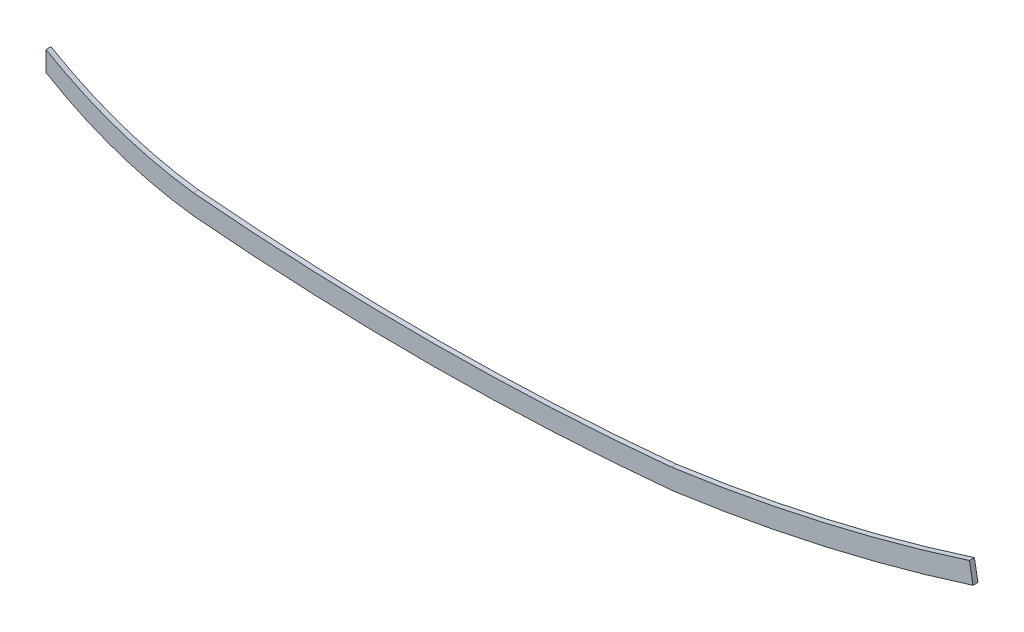
from build123d import *

# Parameters (mm, degrees)
BOSS_EXTRUDE1_DEPTH = 3.175


with BuildPart() as part:
    # Sketch2 → Boss-Extrude1 (new body)
    with BuildSketch(Plane.XY):
        with BuildLine():
            Line((0, -93.726), (0, -81.026))
            ThreePointArc((0, -81.026), (45.355574661, -101.848678718), (93.981781578, -113.082738659))
            ThreePointArc((93.981781578, -113.082738659), (246.372313094, -119.731502028), (398.720709803, -112.17861051))
            ThreePointArc((398.720709803, -112.17861051), (494.586291489, -94.575813643), (588.578984507, -68.779653684))
            Line((588.578984507, -68.779653684), (590.864339182, -81.353629169))
            ThreePointArc((590.864339182, -81.353629169), (496.464017617, -107.14437724), (400.203586993, -124.765753286))
            ThreePointArc((400.203586993, -124.765753286), (247.115945932, -132.400573942), (93.98, -125.805242584))
            ThreePointArc((93.98, -125.805242584), (45.290754419, -114.743765625), (0, -93.726))
        make_face()
    extrude(amount=BOSS_EXTRUDE1_DEPTH)


solid = part.part
